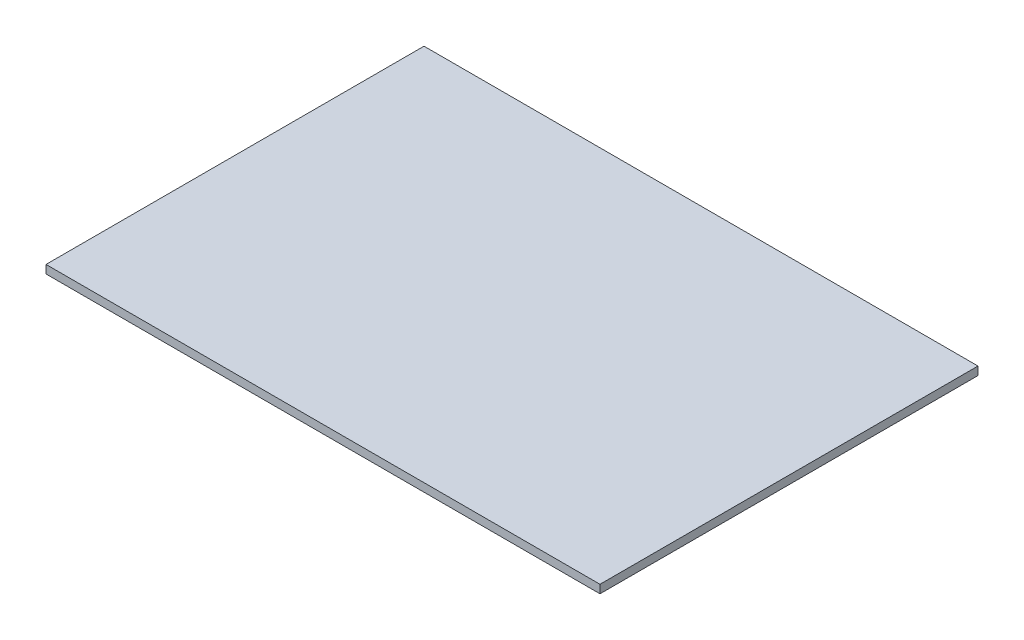
from build123d import *

# Parameters (mm, degrees)
SKETCH1_W           = 850
SKETCH1_H           = 580
BOSS_EXTRUDE1_DEPTH = 12.7


with BuildPart() as part:
    # Sketch1 → Boss-Extrude1 (new body)
    with BuildSketch(Plane(origin=(0, 0, 0), x_dir=(1, 0, 0), z_dir=(0, 1, 0))):
        Rectangle(SKETCH1_W, SKETCH1_H)
    extrude(amount=BOSS_EXTRUDE1_DEPTH)


solid = part.part
